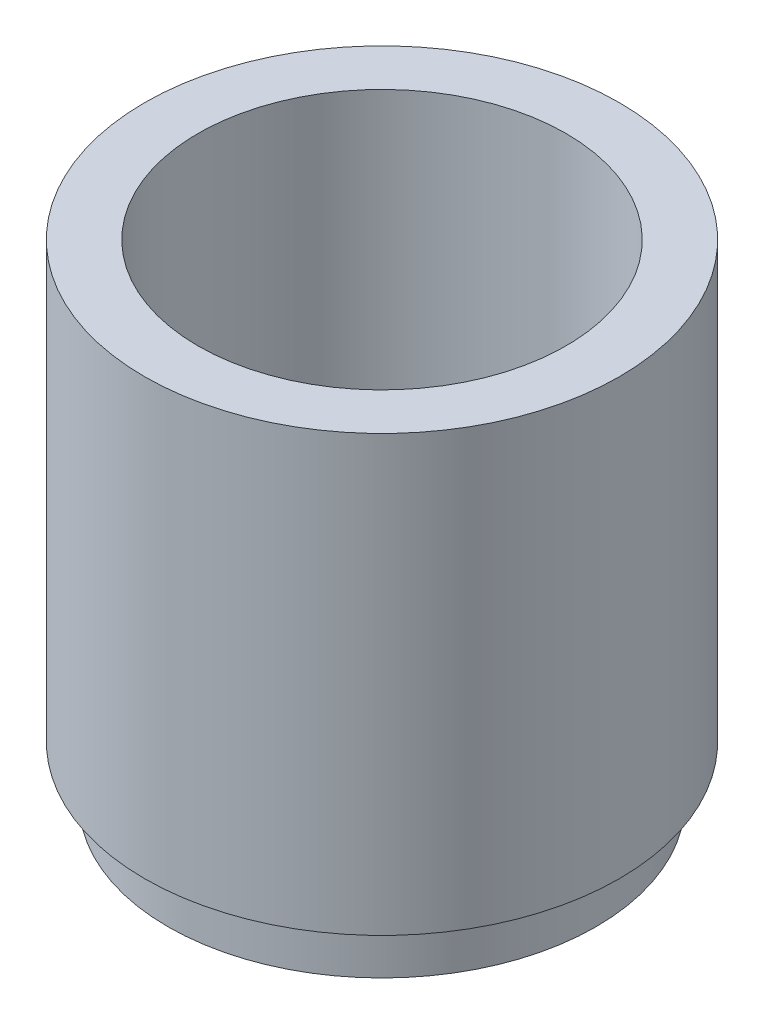
from build123d import *

# Parameters (mm, degrees)
SKETCH1_R           = 8.025
SKETCH1_R_2         = 6.4
BOSS_EXTRUDE1_DEPTH = 2
SKETCH2_R           = 8.9
SKETCH2_R_2         = 6.9
BOSS_EXTRUDE2_DEPTH = 16.3


with BuildPart() as part:
    # Sketch1 → Boss-Extrude1 (new body)
    with BuildSketch(Plane(origin=(0, 0, 0), x_dir=(1, 0, 0), z_dir=(0, 1, 0))):
        Circle(SKETCH1_R)
        Circle(SKETCH1_R_2, mode=Mode.SUBTRACT)
    extrude(amount=BOSS_EXTRUDE1_DEPTH)

    # Sketch2 → Boss-Extrude2 (add)
    with BuildSketch(Plane(origin=(0, 2, 0), x_dir=(1, 0, 0), z_dir=(0, 1, 0))):
        Circle(SKETCH2_R)
        Circle(SKETCH2_R_2, mode=Mode.SUBTRACT)
    extrude(amount=BOSS_EXTRUDE2_DEPTH)


solid = part.part
